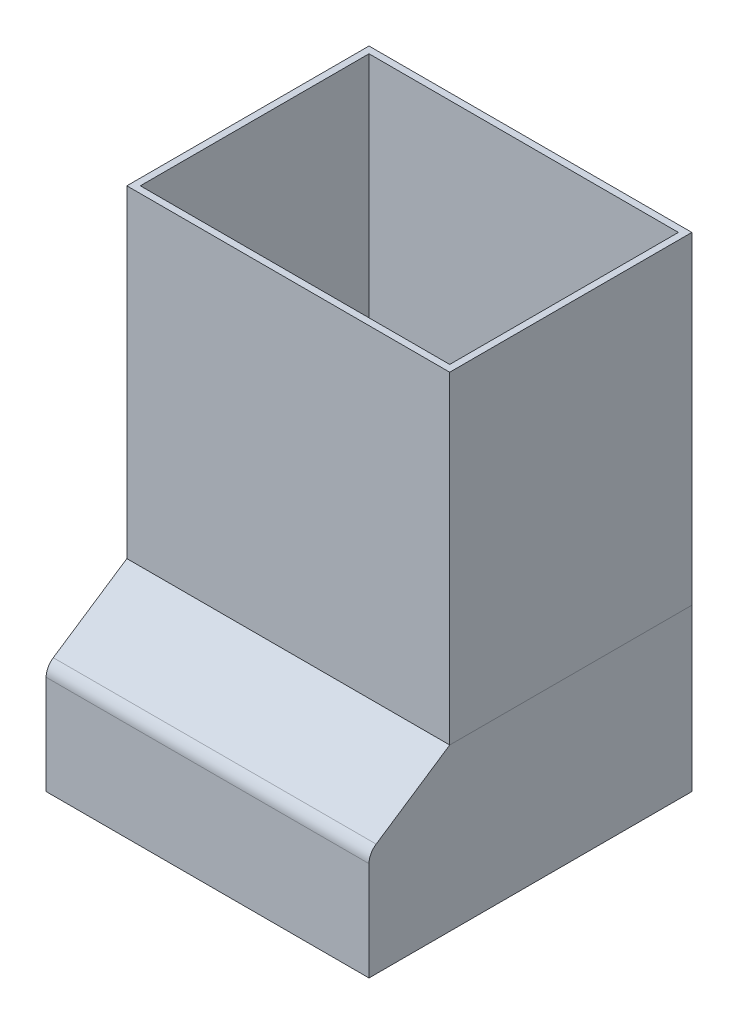
from build123d import *

# Parameters (mm, degrees)
SKETCH1_W               = 609.6
SKETCH1_H               = 609.6
BOSS_EXTRUDE1_DEPTH     = 304.8
CUT_EXTRUDE2_DEPTH      = 747.6044736
CUT_EXTRUDE2_DEPTH_BACK = 609.6
SHELL11_T               = 12.7
SKETCH13_W              = 609.6
SKETCH13_H              = 457.2
BOSS_EXTRUDE7_DEPTH     = 609.6
SHELL13_T               = -12.7
SKETCH14_W              = 127
SKETCH14_H              = 101.6
BOSS_EXTRUDE8_DEPTH     = 152.4
SHELL14_START           = -292.1
SHELL14_OUTLINE_W       = 152.4
SHELL14_OUTLINE_H       = 88.9
SHELL14_DEPTH           = 114.3
SKETCH17_W              = 114.3
SKETCH17_H              = 88.9
CUT_EXTRUDE3_DEPTH      = 237.744
FILLET2_R               = 30.32


# Read off the part's stored shape, not the designer's step: Shell14
with BuildPart() as part:
    # Sketch1 → Boss-Extrude1 (new body)
    with BuildSketch(Plane(origin=(0, 0, 0), x_dir=(1, 0, 0), z_dir=(0, 1, 0))):
        Rectangle(SKETCH1_W, SKETCH1_H)
    extrude(amount=BOSS_EXTRUDE1_DEPTH)

    # Sketch11 → Cut-Extrude2 (cut, two sides: drawn at the far end of the back side and taken through both)
    with BuildSketch(Plane(origin=(304.8, 0, 0), x_dir=(0, 0, -1), z_dir=(1, 0, 0)).offset(-CUT_EXTRUDE2_DEPTH_BACK)):
        Polygon((-1382.429640083, -515.219760055), (-304.8, 203.2), (-152.4, 304.8), (925.229640083, 1023.219760055), (-511.609880028, 3178.47904022), (-2819.269160193, 1640.03952011), align=None)
    extrude(amount=CUT_EXTRUDE2_DEPTH + CUT_EXTRUDE2_DEPTH_BACK, mode=Mode.SUBTRACT)

    # Shell11 (no face opened: a closed hollow body)
    add(offset(amount=-SHELL11_T, mode=Mode.PRIVATE), mode=Mode.SUBTRACT)


with BuildPart() as body_2:
    # Sketch13 → Boss-Extrude7 (new body)
    with BuildSketch(Plane(origin=(0, 304.8, 0), x_dir=(1, 0, 0), z_dir=(0, 1, 0))):
        with Locations((0, 76.2)):
            Rectangle(SKETCH13_W, SKETCH13_H)
    extrude(amount=BOSS_EXTRUDE7_DEPTH)

    # Shell13
    shell13_openings = [body_2.faces().sort_by_distance(p)[0] for p in [
        (0, 914.4, -76.2),
    ]]
    offset(amount=SHELL13_T, openings=shell13_openings, kind=Kind.INTERSECTION)

    # Sketch14 → Boss-Extrude8 (add)
    with BuildSketch(Plane(origin=(0, 317.5, 0), x_dir=(1, 0, 0), z_dir=(0, 1, 0))):
        with Locations((-228.6, -88.9)):
            Rectangle(SKETCH14_W, SKETCH14_H)
    extrude(amount=BOSS_EXTRUDE8_DEPTH)

    # Shell14 outline → Shell14 (cut)
    with BuildSketch(Plane.YZ.offset(SHELL14_START)):
        with Locations((393.7, 95.25)):
            Rectangle(SHELL14_OUTLINE_W, SHELL14_OUTLINE_H)
    extrude(amount=SHELL14_DEPTH, mode=Mode.SUBTRACT)


with BuildPart() as cut_extrude3_tool:
    # Sketch17 → Cut-Extrude3 (new body)
    with BuildSketch(Plane(origin=(0, 317.5, 0), x_dir=(1, 0, 0), z_dir=(0, 1, 0))):
        with Locations((-234.95, -95.25)):
            Rectangle(SKETCH17_W, SKETCH17_H)
    extrude(amount=-CUT_EXTRUDE3_DEPTH)


with BuildPart() as part_1:
    add(part.part)

    # Cut-Extrude3: cut by cut_extrude3_tool
    add(cut_extrude3_tool.part, mode=Mode.SUBTRACT)

    # Fillet2
    fillet2_edges = [part_1.edges().sort_by_distance(p)[0] for p in [
        (0, 203.2, 304.8),
    ]]
    fillet(fillet2_edges, radius=FILLET2_R)


with BuildPart() as body_2_1:
    add(body_2.part)

    # Cut-Extrude3: cut by cut_extrude3_tool
    add(cut_extrude3_tool.part, mode=Mode.SUBTRACT)


solid = Compound([part_1.part, body_2_1.part])
